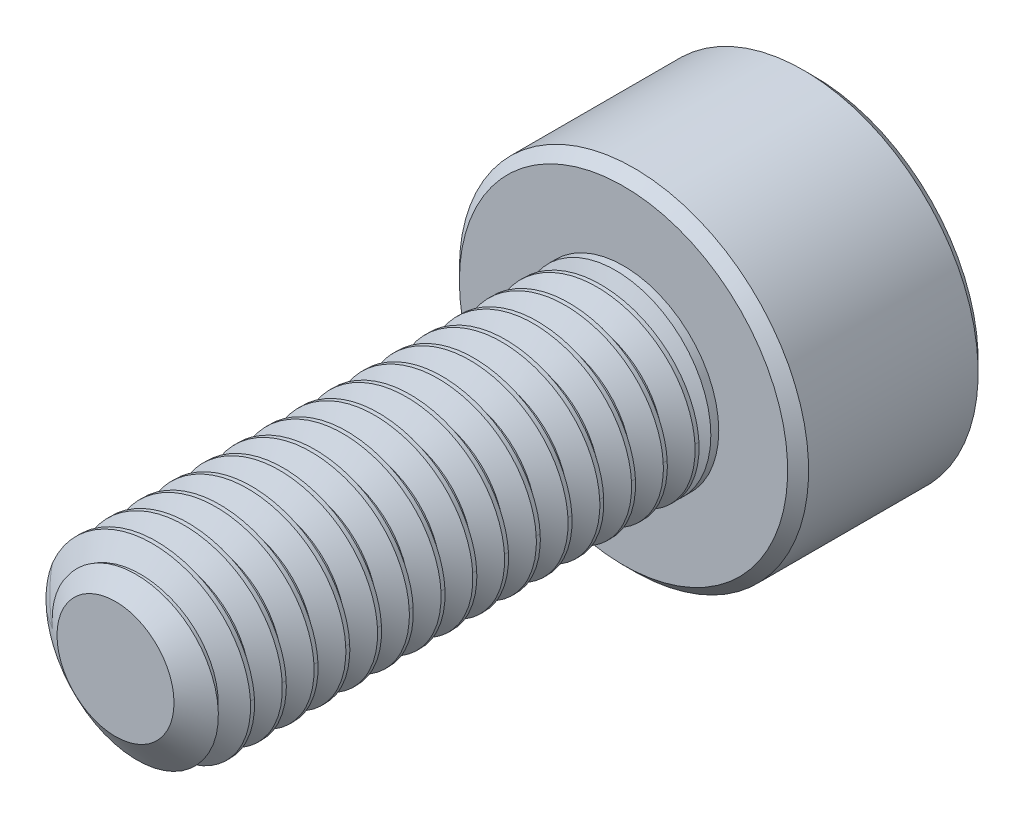
from build123d import *

# Parameters (mm, degrees)
SKETCH1_R          = 1.5
EXTRUDE1_DEPTH     = 8
CUT_SWEEP1_PITCH   = 0.5
SKETCH6_R          = 2.75
EXTRUDE2_DEPTH     = 3
CUT_EXTRUDE1_DEPTH = 1.875
CHAMFER1_SIZE      = 0.165


with BuildPart() as part:
    # Sketch1 → Extrude1 (new body)
    with BuildSketch(Plane.XY):
        Circle(SKETCH1_R)
    extrude(amount=-EXTRUDE1_DEPTH)

    # Cut-Sweep1: arcs per turn and ends read off the stored shape
    # Cut-Sweep1: the profile of Sketch3 profile screwed along a right-hand helix through 19 turns, 6 arcs to a turn; built about Z, then put on its axis
    cut_sweep1_z = Axis((0, 0, 0), (0, 0, 1))
    cut_sweep1_corners = [(1.5003, 0, -0.937673205), (1.175240474, 0, -0.75), (1.175240474, 0, -0.6875), (1.5003, 0, -0.499826795)]
    with BuildLine(mode=Mode.PRIVATE) as cut_sweep1_profile:
        Line(cut_sweep1_corners[0], cut_sweep1_corners[1])
        Line(cut_sweep1_corners[1], cut_sweep1_corners[2])
        Line(cut_sweep1_corners[2], cut_sweep1_corners[3])
        Line(cut_sweep1_corners[3], cut_sweep1_corners[0])
    cut_sweep1_cap = Face(cut_sweep1_profile.wire())
    cut_sweep1_turn_angles = [0, 30, 60, 90, 120, 150, 180, 210, 240, 270, 300, 330, 360]
    cut_sweep1_turn_weights = [1, 0.8660254037844387, 1, 0.8660254037844387, 1, 0.8660254037844387, 1, 0.8660254037844387, 1, 0.8660254037844387, 1, 0.8660254037844387, 1]
    cut_sweep1_turn_rails = [Edge.make_bspline([Vector(p[0], p[1], 0).rotate(cut_sweep1_z, cut_sweep1_turn_angles[k]) / cut_sweep1_turn_weights[k] + Vector(0, 0, p[2] + CUT_SWEEP1_PITCH * cut_sweep1_turn_angles[k] / 360) for k in range(13)], [0, 0, 0, 1, 1, 2, 2, 3, 3, 4, 4, 5, 5, 6, 6, 6], 2, cut_sweep1_turn_weights) for p in cut_sweep1_corners]
    cut_sweep1_turn_sides = [Face.make_surface_from_curves(cut_sweep1_turn_rails[p[0]], cut_sweep1_turn_rails[p[1]]) for p in [(0, 1), (1, 2), (2, 3), (3, 0)]]
    cut_sweep1 = Plane(origin=(0, 0, 0), x_dir=(0, 1, 0), z_dir=(0, 0, -1)) * Solid(Shell([*[p.moved(Location((0, 0, CUT_SWEEP1_PITCH * i))) for i in range(19) for p in cut_sweep1_turn_sides], cut_sweep1_cap, cut_sweep1_cap.rotate(cut_sweep1_z, 6840).moved(Location((0, 0, CUT_SWEEP1_PITCH * 6840 / 360)))]))
    add(cut_sweep1, mode=Mode.SUBTRACT)

    # Sketch4 → Cut-Revolve1 (revolve, cut)
    with BuildSketch(Plane(origin=(0, 0, 0), x_dir=(0, 0, -1), z_dir=(1, 0, 0)), mode=Mode.PRIVATE) as cut_revolve1_sk:
        Polygon((0.405251783, 1.5), (0, 0.921240474), (0, 1.5), align=None)
    revolve(cut_revolve1_sk.sketch.rotate(Axis((0, 0, 0), (0, 0, -1)), 263.352109169), axis=Axis((0, 0, 0), (0, 0, -1)), mode=Mode.SUBTRACT)

    # Sketch6 → Extrude2 (add)
    with BuildSketch(Plane(origin=(0, 0, -8), x_dir=(-1, 0, 0), z_dir=(0, 0, -1))):
        Circle(SKETCH6_R)
    extrude(amount=EXTRUDE2_DEPTH)

    # Sketch7 → Cut-Extrude1 (cut)
    with BuildSketch(Plane(origin=(0, 0, -11), x_dir=(-1, 0, 0), z_dir=(0, 0, -1))):
        Polygon((0, 1.443375673), (-1.25, 0.721687836), (-1.25, -0.721687836), (0, -1.443375673), (1.25, -0.721687836), (1.25, 0.721687836), align=None)
    extrude(amount=-CUT_EXTRUDE1_DEPTH, mode=Mode.SUBTRACT)

    # Cut-Extrude2 cone 1 section (through the dimple's axis) → Cut-Extrude2 (revolve, cut)
    with BuildSketch(Plane(origin=(0, 0, -11), x_dir=(0, 1, 0), z_dir=(1, 0, 0))):
        Polygon((0, 0), (1.443375673, 0), (0, 1.443375673), align=None)
    revolve(axis=Axis((0, 0, -11), (0, 0, 1)), mode=Mode.SUBTRACT)

    # Chamfer1
    chamfer1_edges = [part.edges().sort_by_distance(p)[0] for p in [
        (2.75, 0, -8),
        (2.75, 0, -11),
    ]]
    chamfer(chamfer1_edges, length=CHAMFER1_SIZE)

    # Sketch10 → Revolve1 (revolve)
    with BuildSketch(Plane(origin=(0, 0, 0), x_dir=(0, 0, -1), z_dir=(1, 0, 0)), mode=Mode.PRIVATE) as revolve1_sk:
        Polygon((8, 1.5), (8, 0), (7.253679656, 0), (7.875, 1.5), align=None)
    revolve(revolve1_sk.sketch.rotate(Axis((0, 0, -8), (0, 0, 1)), 270), axis=Axis((0, 0, -8), (0, 0, 1)))


solid = part.part
